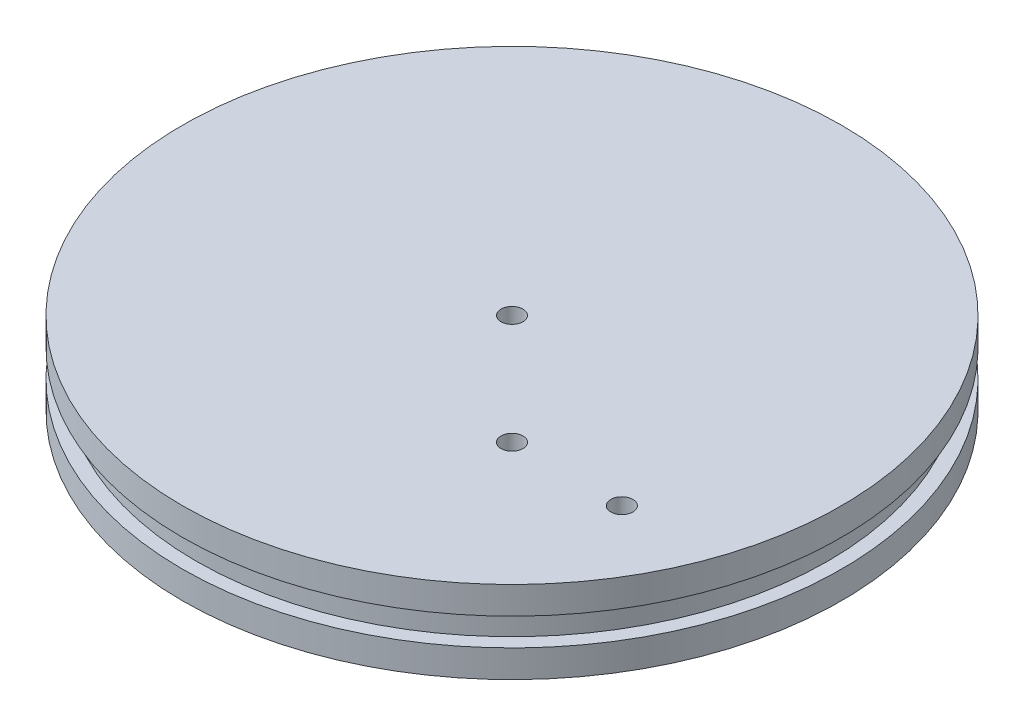
from build123d import *

# Parameters (mm, degrees)
SKETCH1_R           = 76.2
SKETCH1_R_2         = 2.54
BOSS_EXTRUDE1_DEPTH = 19.05
SKETCH2_W           = 3.175
SKETCH2_H           = 6.35


with BuildPart() as part:
    # Sketch1 → Boss-Extrude1 (new body)
    with BuildSketch(Plane(origin=(0, 0, 0), x_dir=(1, 0, 0), z_dir=(0, 1, 0))):
        Circle(SKETCH1_R)
        Circle(SKETCH1_R_2, mode=Mode.SUBTRACT)
        with Locations((25.4, -25.4)):
            Circle(SKETCH1_R_2, mode=Mode.SUBTRACT)
        with Locations((50.8, -25.4)):
            Circle(SKETCH1_R_2, mode=Mode.SUBTRACT)
    extrude(amount=BOSS_EXTRUDE1_DEPTH)

    # Sketch2 → Cut-Revolve1 (revolve, cut)
    with BuildSketch(Plane.XY):
        with Locations((-74.6125, 9.525)):
            Rectangle(SKETCH2_W, SKETCH2_H)
    revolve(axis=Axis((0, 4.7625, 0), (0, 1, 0)), mode=Mode.SUBTRACT)


solid = part.part
